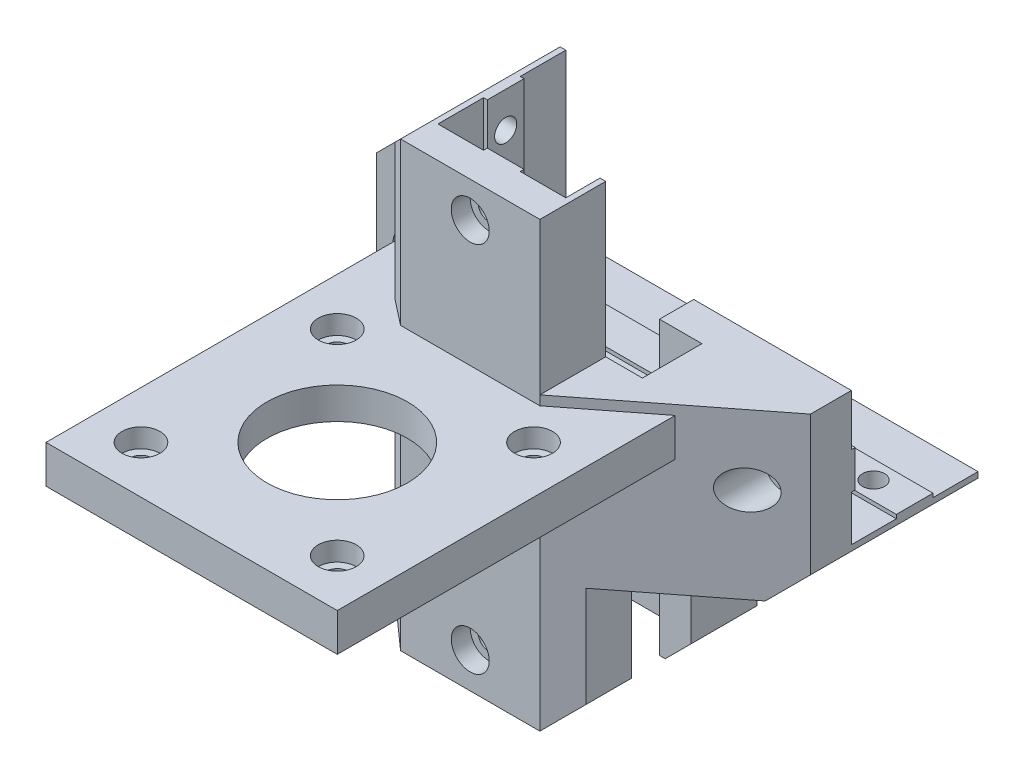
from build123d import *

# Parameters (mm, degrees)
EXTRUDE_1_DEPTH          = 22
CUT_EXTRUDE_2_DEPTH      = 82.358095651
SKETCH_3_W               = 24.9
SKETCH_3_H               = 5.8
EXTRUDE_2_DEPTH          = 0.6
CUT_EXTRUDE_3_DEPTH      = 57.272077989
EXTRUDE_3_DEPTH          = 20
CUT_EXTRUDE_4_DEPTH      = 57.272077989
CUT_EXTRUDE_4_DEPTH_BACK = 57.272077989
SKETCH_7_W               = 19.9
SKETCH_7_H               = 17
CUT_EXTRUDE_5_DEPTH      = 65.954905342
SKETCH_8_W               = 15
SKETCH_8_H               = 20
CUT_EXTRUDE_6_DEPTH      = 67.643957215
CUT_EXTRUDE_7_DEPTH      = 57.509351096
CUT_EXTRUDE_7_DEPTH_BACK = 57.509351096
SKETCH_9_R               = 1.75
SKETCH_10_R              = 1.75
CUT_EXTRUDE_8_DEPTH      = 63.543241308
SKETCH_11_W              = 0.9
SKETCH_11_H              = 24
CUT_EXTRUDE_9_DEPTH      = 10
EXTRUDE_4_DEPTH          = 70
SKETCH_13_W              = 4.1
SKETCH_13_H              = 24
CUT_EXTRUDE_10_DEPTH     = 67.682432179
SKETCH_14_R              = 1.75
CUT_EXTRUDE_11_DEPTH     = 66.197444438
SKETCH_15_W              = 5.8
SKETCH_15_H              = 0.6
EXTRUDE_5_DEPTH          = 70
SKETCH_16_R              = 1.75
CUT_EXTRUDE_12_DEPTH     = 63.05183098
EXTRUDE_START            = -26
EXTRUDE_6_DEPTH          = 26
SKETCH_18_R              = 1.75
CUT_EXTRUDE_13_DEPTH     = 58.511275079
SKETCH_20_R              = 3
CUT_EXTRUDE_17_DEPTH     = 3
SKETCH_21_R              = 3
CUT_EXTRUDE_18_DEPTH     = 20
SKETCH_22_R              = 3
CUT_EXTRUDE_19_DEPTH     = 3
SKETCH_23_R              = 3
CUT_EXTRUDE_20_DEPTH     = 3
CUT_EXTRUDE_START        = -3
SKETCH_24_R              = 3
CUT_EXTRUDE_21_DEPTH     = 3
SKETCH_25_R              = 3
CUT_EXTRUDE_22_DEPTH     = 3
SKETCH_26_W              = 6.7
SKETCH_26_H              = 9.4
CUT_EXTRUDE_23_DEPTH     = 83.281101889
EXTRUDE_START_2          = 6.544802973
EXTRUDE_7_DEPTH          = 6
SKETCH_29_W              = 42.5
SKETCH_29_H              = 42.5
SKETCH_29_R              = 11.1
CUT_EXTRUDE_24_DEPTH     = 1
SKETCH_30_R              = 11.1
CUT_EXTRUDE_25_DEPTH     = 87.637346035
SKETCH_31_R              = 1.75
CUT_EXTRUDE_26_DEPTH     = 90.465243128
SKETCH_35_R              = 3
CUT_EXTRUDE_27_DEPTH     = 3


# Read off the part's stored shape, not the designer's step: 凸台-拉伸7
with BuildPart() as part:
    # 草图1 → 凸台-拉伸1 (new body)
    with BuildSketch(Plane.XY):
        Polygon((-34.855445258, 14.044802973), (-10.855445258, 38.044802973), (11.144554742, 38.044802973), (35.144554742, 14.044802973), (35.144554742, -7.955197027), (11.144554742, -31.955197027), (-10.855445258, -31.955197027), (-34.855445258, -7.955197027), align=None)
    extrude(amount=EXTRUDE_1_DEPTH)

    # 草图2 → 切除-拉伸2 (cut, through all)
    with BuildSketch(Plane(origin=(0, 38.044802973, 0), x_dir=(1, 0, 0), z_dir=(0, 1, 0))):
        Polygon((10.244554742, 0), (-9.955445258, 0), (-9.955445258, -7.2), (-9.355445258, -7.2), (-9.355445258, -13), (-9.955445258, -13), (-9.955445258, -20.2), (-2.755445258, -20.2), (-2.755445258, -19.6), (3.044554742, -19.6), (3.044554742, -20.2), (10.244554742, -20.2), (10.244554742, -14.8), (16.944554742, -14.8), (16.944554742, -5.4), (10.244554742, -5.4), align=None)
    extrude(amount=-CUT_EXTRUDE_2_DEPTH, mode=Mode.SUBTRACT)

    # 草图3 → 凸台-拉伸2 (add)
    with BuildSketch(Plane(origin=(0, 0, 0), x_dir=(-1, 0, 0), z_dir=(0, 0, -1))):
        with Locations((22.405445258, 3.044802973)):
            Rectangle(SKETCH_3_W, SKETCH_3_H)
        with Locations((-22.694554742, 3.044802973)):
            Rectangle(SKETCH_3_W, SKETCH_3_H)
    extrude(amount=EXTRUDE_2_DEPTH)

    # 草图4 → 切除-拉伸3 (cut, through all)
    with BuildSketch(Plane(origin=(0, 0, 0), x_dir=(-1, 0, 0), z_dir=(0, 0, -1))):
        Polygon((-35.144554742, 14.044802973), (-11.144554742, 38.044802973), (-11.144554742, 14.044802973), align=None)
    extrude(amount=-CUT_EXTRUDE_3_DEPTH, mode=Mode.SUBTRACT)

    # 草图5 → 凸台-拉伸3 (add)
    with BuildSketch(Plane(origin=(0, 0, 0), x_dir=(-1, 0, 0), z_dir=(0, 0, -1))):
        Polygon((-11.144554742, -31.955197027), (10.855445258, -31.955197027), (34.855445258, -7.955197027), (34.855445258, -7.055197027), (-35.144554742, -7.055197027), (-35.144554742, -7.955197027), align=None)
    extrude(amount=EXTRUDE_3_DEPTH)

    # 草图6 → 切除-拉伸4 (cut, two sides: drawn at the far end of the back side and taken through both)
    with BuildSketch(Plane(origin=(0, 0, 0), x_dir=(-1, 0, 0), z_dir=(0, 0, -1)).offset(-CUT_EXTRUDE_4_DEPTH_BACK)):
        Polygon((14.955445258, 33.944802973), (30.855445258, 18.044802973), (14.955445258, 18.044802973), align=None)
        Polygon((14.955445258, -11.955197027), (30.855445258, -11.955197027), (14.955445258, -27.855197027), align=None)
        Polygon((-15.244554742, -11.955197027), (-31.144554742, -11.955197027), (-15.244554742, -27.855197027), align=None)
    extrude(amount=CUT_EXTRUDE_4_DEPTH + CUT_EXTRUDE_4_DEPTH_BACK, mode=Mode.SUBTRACT)

    # 草图7 → 切除-拉伸5 (cut, through all)
    with BuildSketch(Plane(origin=(0, 18.044802973, 0), x_dir=(1, 0, 0), z_dir=(0, 1, 0))):
        with Locations((-24.905445258, -13.5)):
            Rectangle(SKETCH_7_W, SKETCH_7_H)
        with Locations((25.194554742, -13.5)):
            Rectangle(SKETCH_7_W, SKETCH_7_H)
    extrude(amount=-CUT_EXTRUDE_5_DEPTH, mode=Mode.SUBTRACT)

    # 草图8 → 切除-拉伸6 (cut, through all)
    with BuildSketch(Plane.ZY.offset(14.955445258)):
        with Locations((-12.5, -21.955197027)):
            Rectangle(SKETCH_8_W, SKETCH_8_H)
    extrude(amount=-CUT_EXTRUDE_6_DEPTH, mode=Mode.SUBTRACT)

    # 草图9 → 切除-拉伸7 (cut, two sides: drawn at the far end of the back side and taken through both)
    with BuildSketch(Plane(origin=(0, 0, -0.6), x_dir=(-1, 0, 0), z_dir=(0, 0, -1)).offset(-CUT_EXTRUDE_7_DEPTH_BACK)):
        with Locations((-29.544554742, 3.044802973)):
            Circle(SKETCH_9_R)
        with Locations((29.255445258, 3.044802973)):
            Circle(SKETCH_9_R)
        with Locations((-0.144554742, 32.444802973)):
            Circle(SKETCH_9_R)
        with Locations((-0.144554742, -26.355197027)):
            Circle(SKETCH_9_R)
    extrude(amount=CUT_EXTRUDE_7_DEPTH + CUT_EXTRUDE_7_DEPTH_BACK, mode=Mode.SUBTRACT)

    # 草图10 → 切除-拉伸8 (cut, through all)
    with BuildSketch(Plane(origin=(-9.355445258, 0, 0), x_dir=(0, 0, -1), z_dir=(1, 0, 0))):
        with Locations((-10.1, 32.444802973)):
            Circle(SKETCH_10_R)
        with Locations((-10.1, -26.355197027)):
            Circle(SKETCH_10_R)
        with Locations((-10.1, 3.044802973)):
            Circle(SKETCH_10_R)
    extrude(amount=-CUT_EXTRUDE_8_DEPTH, mode=Mode.SUBTRACT)

    # 草图11 → 切除-拉伸9 (cut)
    with BuildSketch(Plane(origin=(0, 0, 0), x_dir=(-1, 0, 0), z_dir=(0, 0, -1))):
        with Locations((-10.694554742, 26.044802973)):
            Rectangle(SKETCH_11_W, SKETCH_11_H)
    extrude(amount=-CUT_EXTRUDE_9_DEPTH, mode=Mode.SUBTRACT)

    # 草图12 → 凸台-拉伸4 (add)
    with BuildSketch(Plane(origin=(0, 38.044802973, 0), x_dir=(1, 0, 0), z_dir=(0, 1, 0))):
        Polygon((-14.955445258, -22), (-10.855445258, -25.2), (11.144554742, -25.2), (15.244554742, -22), align=None)
    extrude(amount=-EXTRUDE_4_DEPTH)

    # 草图13 → 切除-拉伸10 (cut, through all)
    with BuildSketch(Plane(origin=(0, 0, 22), x_dir=(-1, 0, 0), z_dir=(0, 0, -1))):
        Polygon((10.855445258, 38.044802973), (14.955445258, 38.044802973), (14.955445258, 33.944802973), align=None)
        with Locations((-13.194554742, 26.044802973)):
            Rectangle(SKETCH_13_W, SKETCH_13_H)
        Polygon((14.955445258, -27.855197027), (14.955445258, -31.955197027), (10.855445258, -31.955197027), align=None)
        Polygon((-15.244554742, -31.955197027), (-11.144554742, -31.955197027), (-15.244554742, -27.855197027), align=None)
    extrude(amount=-CUT_EXTRUDE_10_DEPTH, mode=Mode.SUBTRACT)

    # 草图14 → 切除-拉伸11 (cut, through all)
    with BuildSketch(Plane(origin=(0, 0, 19.6), x_dir=(-1, 0, 0), z_dir=(0, 0, -1))):
        with Locations((-0.144554742, 32.444802973)):
            Circle(SKETCH_14_R)
        with Locations((-0.144554742, -26.355197027)):
            Circle(SKETCH_14_R)
    extrude(amount=-CUT_EXTRUDE_11_DEPTH, mode=Mode.SUBTRACT)

    # 草图15 → 凸台-拉伸5 (add)
    with BuildSketch(Plane.ZY.offset(34.855445258)):
        with Locations((-10, -6.755197027)):
            Rectangle(SKETCH_15_W, SKETCH_15_H)
    extrude(amount=-EXTRUDE_5_DEPTH)

    # 草图16 → 切除-拉伸12 (cut, through all)
    with BuildSketch(Plane(origin=(0, -6.455197027, 0), x_dir=(1, 0, 0), z_dir=(0, 1, 0))):
        with Locations(Location((-28.355445258, 10, 0), (0, 0, 180))):
            Circle(SKETCH_16_R)
        with Locations(Location((28.644554742, 10, 0), (0, 0, 180))):
            Circle(SKETCH_16_R)
        with Locations(Location((0.144554742, 10, 0), (0, 0, 180))):
            Circle(SKETCH_16_R)
    extrude(amount=-CUT_EXTRUDE_12_DEPTH, mode=Mode.SUBTRACT)

    # 草图17 → 凸台-拉伸6 (add)
    with BuildSketch(Plane(origin=(0, 14.044802973, 0), x_dir=(1, 0, 0), z_dir=(0, 1, 0)).offset(EXTRUDE_START)):
        Polygon((15.244554742, -5), (15.244554742, -22), (35.144554742, -6.468292683), (35.144554742, -5), align=None)
    extrude(amount=EXTRUDE_6_DEPTH)

    # 草图18 → 切除-拉伸13 (cut, through all)
    with BuildSketch(Plane(origin=(0, 0, 5), x_dir=(-1, 0, 0), z_dir=(0, 0, -1))):
        with Locations((-29.544554742, 3.044802973)):
            Circle(SKETCH_18_R)
        Polygon((-35.144554742, -11.955197027), (-35.144554742, -7.955197027), (-31.144554742, -11.955197027), align=None)
    extrude(amount=-CUT_EXTRUDE_13_DEPTH, mode=Mode.SUBTRACT)

    # 草图20 → 切除-拉伸17 (cut)
    with BuildSketch(Plane.XY.offset(25.2)):
        with Locations((0.144554742, 32.444802973)):
            Circle(SKETCH_20_R)
        with Locations((0.144554742, -26.355197027)):
            Circle(SKETCH_20_R)
    extrude(amount=-CUT_EXTRUDE_17_DEPTH, mode=Mode.SUBTRACT)

    # 草图21 → 切除-拉伸18 (cut)
    with BuildSketch(Plane.XY.offset(25.2)):
        with Locations((29.544554742, 3.044802973)):
            Circle(SKETCH_21_R)
    extrude(amount=-CUT_EXTRUDE_18_DEPTH, mode=Mode.SUBTRACT)

    # 草图22 → 切除-拉伸19 (cut)
    with BuildSketch(Plane.ZY.offset(14.955445258)):
        with Locations(Location((10.1, 32.444802973, 0), (0, 0, 270))):
            Circle(SKETCH_22_R)
        with Locations(Location((10.1, 3.044802973, 0), (0, 0, 270))):
            Circle(SKETCH_22_R)
        with Locations(Location((10.1, -26.355197027, 0), (0, 0, 270))):
            Circle(SKETCH_22_R)
    extrude(amount=-CUT_EXTRUDE_19_DEPTH, mode=Mode.SUBTRACT)

    # 草图23 → 切除-拉伸20 (cut)
    with BuildSketch(Plane.XZ.offset(11.955197027)):
        with Locations(Location((-28.355445258, -10, 0), (0, 0, 270))):
            Circle(SKETCH_23_R)
        with Locations(Location((0.144554742, -10, 0), (0, 0, 270))):
            Circle(SKETCH_23_R)
        with Locations(Location((28.644554742, -10, 0), (0, 0, 270))):
            Circle(SKETCH_23_R)
    extrude(amount=-CUT_EXTRUDE_20_DEPTH, mode=Mode.SUBTRACT)

    # 草图24 → 切除-拉伸21 (cut)
    with BuildSketch(Plane(origin=(0, 0, -5), x_dir=(-1, 0, 0), z_dir=(0, 0, -1)).offset(CUT_EXTRUDE_START)):
        with Locations(Location((-0.144554742, -26.355197027, 0), (0, 0, 180))):
            Circle(SKETCH_24_R)
    extrude(amount=CUT_EXTRUDE_21_DEPTH, mode=Mode.SUBTRACT)

    # 草图25 → 切除-拉伸22 (cut)
    with BuildSketch(Plane.XY.offset(5)):
        with Locations((-29.255445258, 3.044802973)):
            Circle(SKETCH_25_R)
    extrude(amount=-CUT_EXTRUDE_22_DEPTH, mode=Mode.SUBTRACT)

    # 草图26 → 切除-拉伸23 (cut, through all)
    with BuildSketch(Plane(origin=(0, 38.044802973, 0), x_dir=(1, 0, 0), z_dir=(0, 1, 0))):
        with Locations((13.594554742, -10.1)):
            Rectangle(SKETCH_26_W, SKETCH_26_H)
    extrude(amount=-CUT_EXTRUDE_23_DEPTH, mode=Mode.SUBTRACT)

    # 凸台-拉伸7 outline → 凸台-拉伸7 (add)
    with BuildSketch(Plane(origin=(0, 0, 0), x_dir=(1, 0, 0), z_dir=(0, 1, 0)).offset(EXTRUDE_START_2)):
        Polygon((-22.855445258, -5), (-22.855445258, -69.2), (23.144554742, -69.2), (23.144554742, -15.834146341), (11.144554742, -25.2), (-10.855445258, -25.2), (-14.955445258, -22), (-14.955445258, -5), align=None)
    extrude(amount=EXTRUDE_7_DEPTH)

    # 草图29 → 切除-拉伸24 (cut)
    with BuildSketch(Plane.XZ.offset(-6.544802973)):
        with Locations((0.144554742, 46.45)):
            Rectangle(SKETCH_29_W, SKETCH_29_H)
        with Locations((0.144554742, 46.2)):
            Circle(SKETCH_29_R, mode=Mode.SUBTRACT)
    extrude(amount=-CUT_EXTRUDE_24_DEPTH, mode=Mode.SUBTRACT)

    # 草图30 → 切除-拉伸25 (cut, through all)
    with BuildSketch(Plane.XZ.offset(-6.544802973)):
        with Locations((0.144554742, 46.2)):
            Circle(SKETCH_30_R)
    extrude(amount=-CUT_EXTRUDE_25_DEPTH, mode=Mode.SUBTRACT)

    # 草图31 → 切除-拉伸26 (cut, through all)
    with BuildSketch(Plane(origin=(0, 12.544802973, 0), x_dir=(1, 0, 0), z_dir=(0, 1, 0))):
        with Locations(Location((-15.355445258, -30.7, 0), (0, 0, 180))):
            Circle(SKETCH_31_R)
        with Locations((15.644554742, -30.7)):
            Circle(SKETCH_31_R)
        with Locations(Location((15.644554742, -61.7, 0), (0, 0, 180))):
            Circle(SKETCH_31_R)
        with Locations((-15.355445258, -61.7)):
            Circle(SKETCH_31_R)
    extrude(amount=-CUT_EXTRUDE_26_DEPTH, mode=Mode.SUBTRACT)

    # 草图35 → 切除-拉伸27 (cut)
    with BuildSketch(Plane(origin=(0, 12.544802973, 0), x_dir=(1, 0, 0), z_dir=(0, 1, 0))):
        with Locations(Location((-15.355445258, -30.7, 0), (0, 0, 180))):
            Circle(SKETCH_35_R)
        with Locations(Location((15.644554742, -30.7, 0), (0, 0, 180))):
            Circle(SKETCH_35_R)
        with Locations(Location((15.644554742, -61.7, 0), (0, 0, 180))):
            Circle(SKETCH_35_R)
        with Locations(Location((-15.355445258, -61.7, 0), (0, 0, 180))):
            Circle(SKETCH_35_R)
    extrude(amount=-CUT_EXTRUDE_27_DEPTH, mode=Mode.SUBTRACT)


solid = part.part
